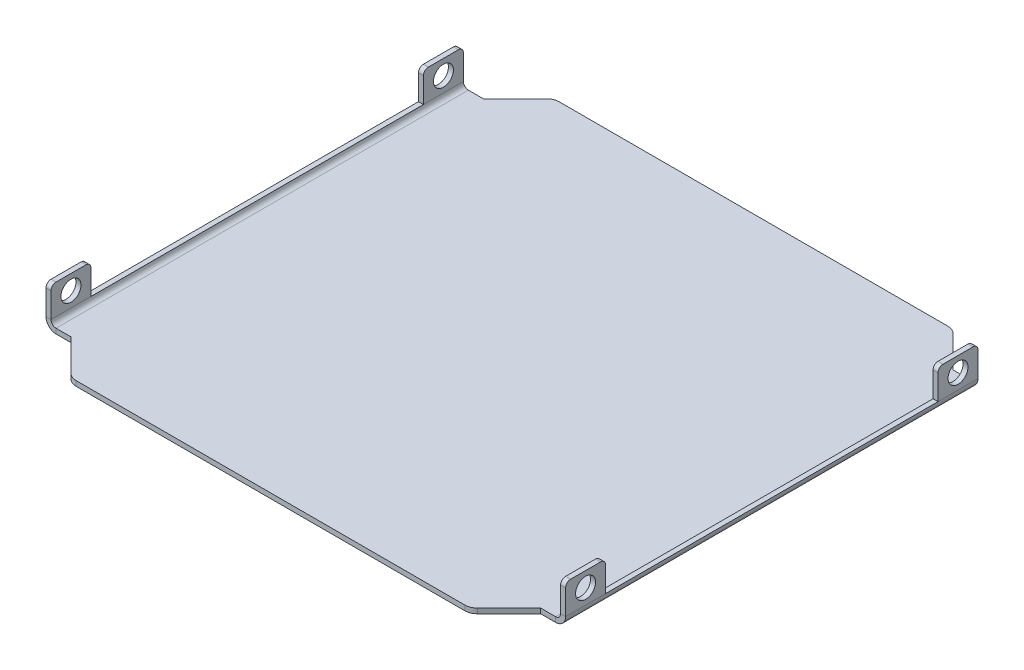
from build123d import *

# Parameters (mm, degrees)
BASE_FLANGE2_DEPTH             = 1
EDGE_FLANGE1_STRIP_W           = 6
EDGE_FLANGE1_STRIP_H           = 1
EDGE_FLANGE1_STRIP_CUT_DEPTH   = 82.6
EDGE_FLANGE1_STRIP_2_W         = 6
EDGE_FLANGE1_STRIP_2_H         = 1
EDGE_FLANGE1_STRIP_CUT_2_DEPTH = 82.6
EDGE_FLANGE1_DEPTH             = 82.6
EDGE_FLANGE1_BEND_DEPTH        = 82.6
SKETCH16_W                     = 66.6
SKETCH16_H                     = 7
CUT_EXTRUDE1_DEPTH             = 138.553195479
FILLET1_R                      = 1
SKETCH17_R                     = 2
CUT_EXTRUDE2_DEPTH             = 138.553195479
FILLET2_R                      = 2.5


# Sheet-metal steps are written as plain solids
with BuildPart() as part:
    # Sketch1 → Base-Flange2 (new body)
    with BuildSketch(Plane(origin=(0, 0, 0), x_dir=(1, 0, 0), z_dir=(0, 1, 0))):
        Polygon((0, 0), (0, 82.6), (5, 82.6), (12.071067812, 89.671067812), (92.000932188, 89.671067812), (99.072, 82.6), (104.072, 82.6), (104.072, 0), (99.072, 0), (92.000932188, -7.071067812), (12.071067812, -7.071067812), (5, 0), align=None)
    extrude(amount=-BASE_FLANGE2_DEPTH)

    # Edge-Flange1 strip (across the edge) → Edge-Flange1 strip cut (cut)
    with BuildSketch(Plane(origin=(104.072, 0, 0), x_dir=(-1, 0, 0), z_dir=(0, 0, -1))):
        with Locations((-1, -0.5)):
            Rectangle(EDGE_FLANGE1_STRIP_W, EDGE_FLANGE1_STRIP_H)
    extrude(amount=EDGE_FLANGE1_STRIP_CUT_DEPTH, mode=Mode.SUBTRACT)

    # Edge-Flange1 strip 2 (across the edge) → Edge-Flange1 strip cut 2 (cut)
    with BuildSketch(Plane.XY.offset(-82.6)):
        with Locations((-1, -0.5)):
            Rectangle(EDGE_FLANGE1_STRIP_2_W, EDGE_FLANGE1_STRIP_2_H)
    extrude(amount=EDGE_FLANGE1_STRIP_CUT_2_DEPTH, mode=Mode.SUBTRACT)

    # Edge-Flange1 section (across the edge) → Edge-Flange1 (add)
    with BuildSketch(Plane(origin=(104.072, 0, 0), x_dir=(-1, 0, 0), z_dir=(0, 0, -1))):
        with BuildLine():
            Line((0, 1), (0, 7))
            Line((0, 7), (1, 7))
            Line((1, 7), (1, 1))
            ThreePointArc((1, 1), (1.292893219, 0.292893219), (2, 0))
            Line((2, 0), (2, -1))
            ThreePointArc((2, -1), (0.585786438, -0.414213562), (0, 1))
        make_face()
    extrude(amount=EDGE_FLANGE1_DEPTH)

    # Edge-Flange1 section 2 (across the edge) → Edge-Flange1 bend (add)
    with BuildSketch(Plane.XY.offset(-82.6)):
        with BuildLine():
            Line((0, 1), (0, 7))
            Line((0, 7), (1, 7))
            Line((1, 7), (1, 1))
            ThreePointArc((1, 1), (1.292893219, 0.292893219), (2, 0))
            Line((2, 0), (2, -1))
            ThreePointArc((2, -1), (0.585786438, -0.414213562), (0, 1))
        make_face()
    extrude(amount=EDGE_FLANGE1_BEND_DEPTH)

    # Sketch16 → Cut-Extrude1 (cut, through all)
    with BuildSketch(Plane(origin=(104.072, 0, 0), x_dir=(0, 0, -1), z_dir=(1, 0, 0))):
        with Locations((41.3, 4.5)):
            Rectangle(SKETCH16_W, SKETCH16_H)
    extrude(amount=-CUT_EXTRUDE1_DEPTH, mode=Mode.SUBTRACT)

    # Fillet1
    fillet1_edges = [part.edges().sort_by_distance(p)[0] for p in [
        (0.5, 7, -74.6),
        (0.5, 7, -8),
        (103.572, 7, -8),
        (103.572, 7, -74.6),
        (103.572, 7, 0),
        (103.572, 7, -82.6),
        (0.5, 7, -82.6),
        (0.5, 7, 0),
    ]]
    fillet(fillet1_edges, radius=FILLET1_R)

    # Sketch17 → Cut-Extrude2 (cut, through all)
    with BuildSketch(Plane(origin=(104.072, 0, 0), x_dir=(0, 0, -1), z_dir=(1, 0, 0))):
        with Locations(Location((4, 4, 0), (0, 0, 90))):
            Circle(SKETCH17_R)
        with Locations(Location((78.6, 4, 0), (0, 0, 90))):
            Circle(SKETCH17_R)
    extrude(amount=-CUT_EXTRUDE2_DEPTH, mode=Mode.SUBTRACT)

    # Fillet2
    fillet2_edges = [part.edges().sort_by_distance(p)[0] for p in [
        (12.071067812, -0.5, -89.671067812),
        (92.000932188, -0.5, -89.671067812),
        (92.000932188, -0.5, 7.071067812),
        (12.071067812, -0.5, 7.071067812),
    ]]
    fillet(fillet2_edges, radius=FILLET2_R)


solid = part.part
